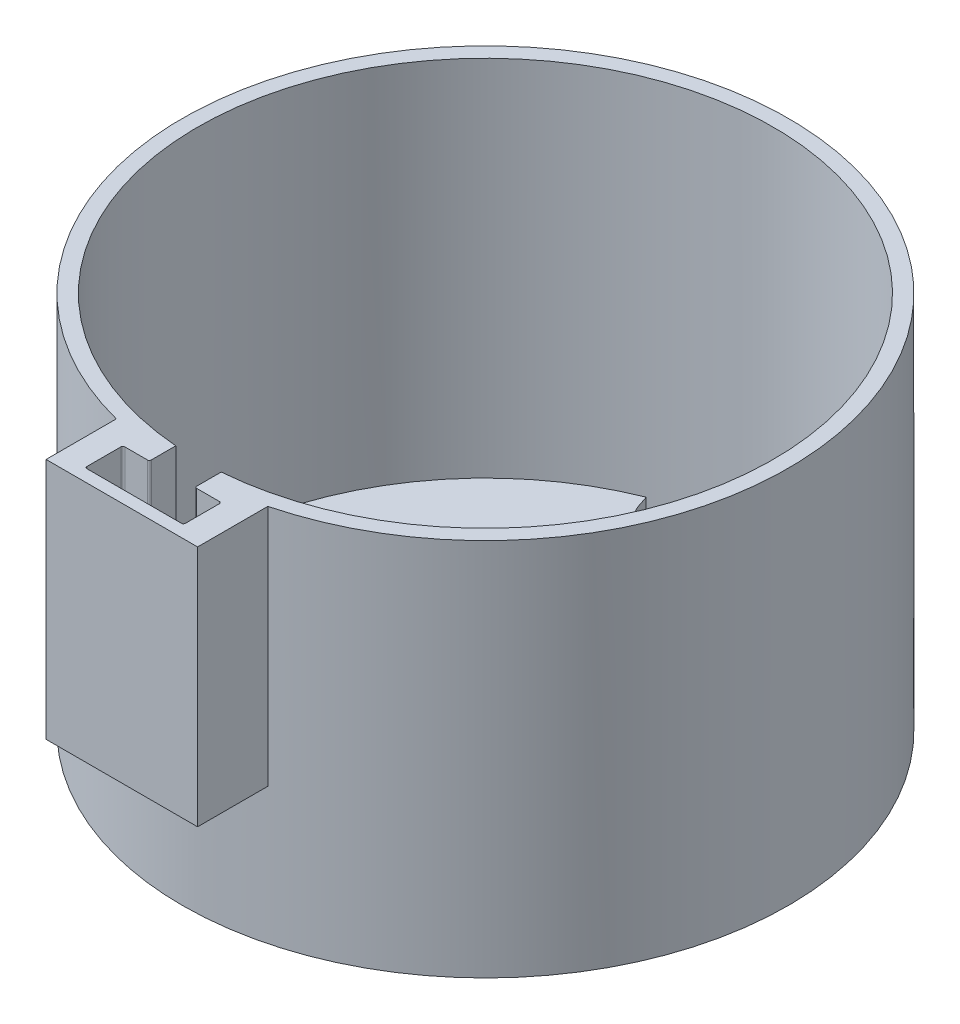
from build123d import *

# Parameters (mm, degrees)
SKETCH1_R           = 40
BOSS_EXTRUDE1_DEPTH = 40
SKETCH2_R           = 38
CUT_EXTRUDE1_DEPTH  = 38
CUT_EXTRUDE2_DEPTH  = 38
SKETCH4_R           = 5
CUT_EXTRUDE3_DEPTH  = 38
SKETCH6_R           = 2
BOSS_EXTRUDE2_DEPTH = 2
SKETCH9_R           = 40
SKETCH9_R_2         = 38
BOSS_EXTRUDE3_DEPTH = 10
BOSS_EXTRUDE4_DEPTH = 32
CUT_EXTRUDE4_DEPTH  = 30
FILLET1_R           = 0.25
SKETCH13_R          = 3
CUT_EXTRUDE5_DEPTH  = 10


with BuildPart() as part:
    # Sketch1 → Boss-Extrude1 (new body)
    with BuildSketch(Plane(origin=(0, 0, 0), x_dir=(1, 0, 0), z_dir=(0, 1, 0))):
        Circle(SKETCH1_R)
    extrude(amount=BOSS_EXTRUDE1_DEPTH)

    # Sketch2 → Cut-Extrude1 (cut)
    with BuildSketch(Plane(origin=(0, 40, 0), x_dir=(1, 0, 0), z_dir=(0, 1, 0))):
        Circle(SKETCH2_R)
    extrude(amount=-CUT_EXTRUDE1_DEPTH, mode=Mode.SUBTRACT)

    # Sketch3 → Cut-Extrude2 (cut)
    with BuildSketch(Plane(origin=(0, 2, 0), x_dir=(1, 0, 0), z_dir=(0, 1, 0))):
        with BuildLine():
            ThreePointArc((-14.076066703, 35.296803626), (0, 24.534862453), (14.076066703, 35.296803626))
            ThreePointArc((14.076066703, 35.296803626), (0, 38), (-14.076066703, 35.296803626))
        make_face()
    extrude(amount=-CUT_EXTRUDE2_DEPTH, mode=Mode.SUBTRACT)

    # Sketch4 → Cut-Extrude3 (cut)
    with BuildSketch(Plane(origin=(0, 2, 0), x_dir=(1, 0, 0), z_dir=(0, 1, 0))):
        Circle(SKETCH4_R)
    extrude(amount=-CUT_EXTRUDE3_DEPTH, mode=Mode.SUBTRACT)

    # Sketch6 → Boss-Extrude2 (add)
    with BuildSketch(Plane.XZ):
        with Locations((-20, 0)):
            Circle(SKETCH6_R)
        with Locations((20, 0)):
            Circle(SKETCH6_R)
    extrude(amount=BOSS_EXTRUDE2_DEPTH)

    # Sketch9 → Boss-Extrude3 (add)
    with BuildSketch(Plane(origin=(0, 40, 0), x_dir=(1, 0, 0), z_dir=(0, 1, 0))):
        Circle(SKETCH9_R)
        Circle(SKETCH9_R_2, mode=Mode.SUBTRACT)
    extrude(amount=BOSS_EXTRUDE3_DEPTH)

    # Sketch10 → Boss-Extrude4 (add)
    with BuildSketch(Plane(origin=(0, 50, 0), x_dir=(1, 0, 0), z_dir=(0, 1, 0))):
        Polygon((0, -38), (10, -38), (10, -48), (-10, -48), (-10, -38), align=None)
    extrude(amount=-BOSS_EXTRUDE4_DEPTH)

    # Sketch11 → Cut-Extrude4 (cut)
    with BuildSketch(Plane(origin=(0, 50, 0), x_dir=(1, 0, 0), z_dir=(0, 1, 0))):
        Polygon((-3, -36.864916731), (3, -36.864916731), (3, -41.364916731), (6.5, -41.364916731), (6.5, -46.364916731), (-6.5, -46.364916731), (-6.5, -41.364916731), (-3, -41.364916731), align=None)
    extrude(amount=-CUT_EXTRUDE4_DEPTH, mode=Mode.SUBTRACT)

    # Fillet1
    fillet1_edges = [part.edges().sort_by_distance(p)[0] for p in [
        (-3, 35, 41.364916731),
        (3, 35, 41.364916731),
        (6.5, 35, 41.364916731),
        (-6.5, 35, 41.364916731),
        (6.5, 35, 46.364916731),
        (-6.5, 35, 46.364916731),
    ]]
    fillet(fillet1_edges, radius=FILLET1_R)

    # Sketch13 → Cut-Extrude5 (cut)
    with BuildSketch(Plane.XZ):
        with Locations((-30, 0)):
            Circle(SKETCH13_R)
        with Locations((30, 0)):
            Circle(SKETCH13_R)
    extrude(amount=-CUT_EXTRUDE5_DEPTH, mode=Mode.SUBTRACT)


solid = part.part
